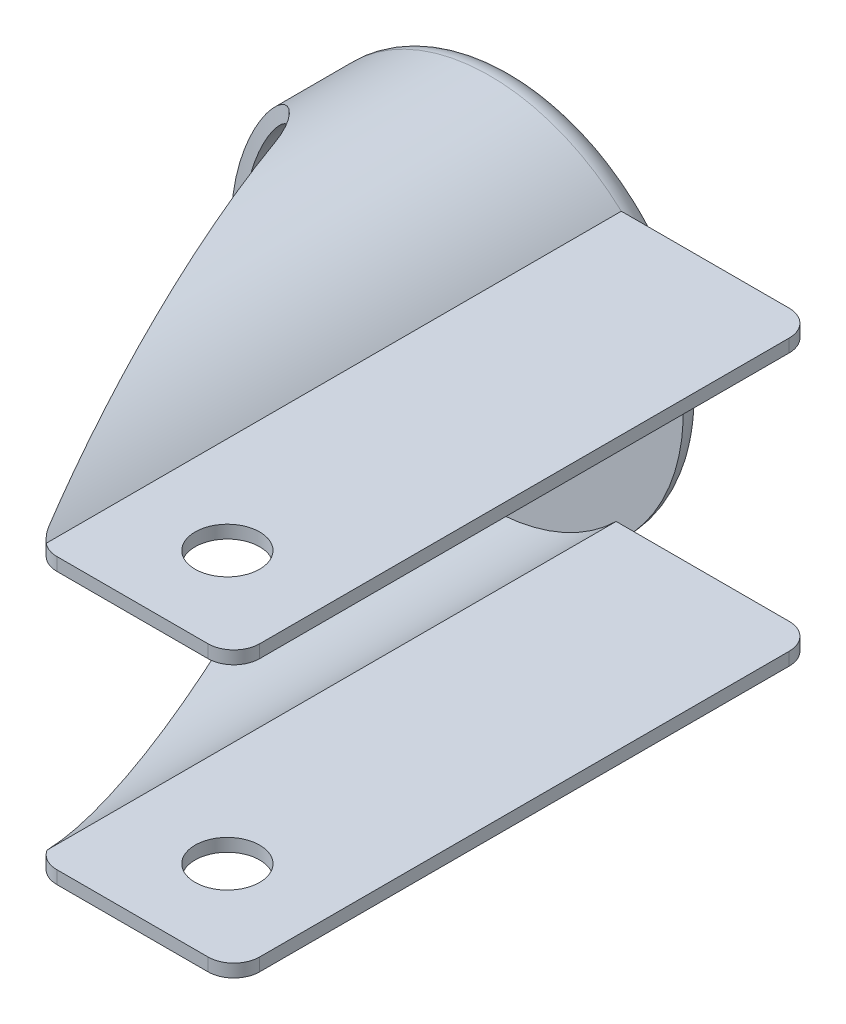
from build123d import *

# Parameters (mm, degrees)
EXTRUDE_1_DEPTH          = 45
SHELL_11_T               = -1
CUT_EXTRUDE_3_DEPTH      = 54.711648372
CUT_EXTRUDE_3_DEPTH_BACK = 54.711648372
CUT_EXTRUDE_5_DEPTH      = 58.757607161
CUT_EXTRUDE_5_DEPTH_BACK = 58.757607161
SKETCH_3_R               = 2.5
EXTRUDE_START            = 2
SKETCH_5_R               = 15
EXTRUDE_4_DEPTH          = 2
FILLET_5_R               = 2
CUT_EXTRUDE_6_DEPTH      = 56.398025084
CUT_EXTRUDE_6_DEPTH_BACK = 56.398025084
SKETCH_6_R               = 5
FILLET_6_R               = 2
FILLET_7_R               = 2


with BuildPart() as part:
    # 草图1 → 凸台-拉伸1 (new body)
    with BuildSketch(Plane.XY):
        with BuildLine():
            Line((10.198039027, -11), (25.198039027, -11))
            Line((25.198039027, -11), (25.198039027, 11))
            Line((25.198039027, 11), (10.198039027, 11))
            ThreePointArc((10.198039027, 11), (-15, 0), (10.198039027, -11))
        make_face()
    extrude(amount=EXTRUDE_1_DEPTH)

    # 抽壳11
    shell_11_openings = [part.faces().sort_by_distance(p)[0] for p in [
        (5.138978192, 0, 45),
        (5.138978192, 0, 0),
        (25.198039027, 0, 22.5),
    ]]
    offset(amount=SHELL_11_T, openings=shell_11_openings, kind=Kind.INTERSECTION)

    # 草图2 → 切除-拉伸3 (cut, two sides: drawn at the far end of the back side and taken through both)
    with BuildSketch(Plane(origin=(0, 0, 0), x_dir=(1, 0, 0), z_dir=(0, 1, 0)).offset(-CUT_EXTRUDE_3_DEPTH_BACK)):
        with BuildLine():
            Line((10.198039027, -45), (-4.526158017, -12.089687708))
            ThreePointArc((-4.526158017, -12.089687708), (-8.753229506, -7.052958097), (-15, -5))
            Line((-15, -5), (-15, -45))
            Line((-15, -45), (10.198039027, -45))
        make_face()
    extrude(amount=CUT_EXTRUDE_3_DEPTH + CUT_EXTRUDE_3_DEPTH_BACK, mode=Mode.SUBTRACT)

    # 草图3 → 切除-拉伸5 (cut, two sides: drawn at the far end of the back side and taken through both)
    with BuildSketch(Plane(origin=(0, 11, 0), x_dir=(1, 0, 0), z_dir=(0, 1, 0)).offset(-CUT_EXTRUDE_5_DEPTH_BACK)):
        with Locations(Location((17.698039027, -38, 0), (0, 0, 270))):
            Circle(SKETCH_3_R)
    extrude(amount=CUT_EXTRUDE_5_DEPTH + CUT_EXTRUDE_5_DEPTH_BACK, mode=Mode.SUBTRACT)

    # 草图5 → 凸台-拉伸4 (add)
    with BuildSketch(Plane(origin=(0, 0, 0), x_dir=(-1, 0, 0), z_dir=(0, 0, -1)).offset(EXTRUDE_START)):
        Circle(SKETCH_5_R)
    extrude(amount=-EXTRUDE_4_DEPTH)

    # 圆角5
    # the kernel refuses this fillet: 2 mm, written as the material it takes off along each edge
    with BuildSketch(Plane(origin=(0, 0, -2), x_dir=(-1, 0, 0), z_dir=(0, -1, 0))) as fillet_5_piece_1:
        with BuildLine():
            CenterArc((15 - FILLET_5_R, -FILLET_5_R), FILLET_5_R, 0, 90)
            Line((15 - FILLET_5_R, 0), (15, 0))
            Line((15, 0), (15, -FILLET_5_R))
        make_face()
    revolve(axis=Axis((0, 0, -2), (0, 0, -1)), mode=Mode.SUBTRACT)

    # 草图6 → 切除-拉伸6 (cut, two sides: drawn at the far end of the back side and taken through both)
    with BuildSketch(Plane(origin=(0, 0, -2), x_dir=(-1, 0, 0), z_dir=(0, 0, -1)).offset(-CUT_EXTRUDE_6_DEPTH_BACK)):
        Circle(SKETCH_6_R)
    extrude(amount=CUT_EXTRUDE_6_DEPTH + CUT_EXTRUDE_6_DEPTH_BACK, mode=Mode.SUBTRACT)

    # 圆角6
    fillet_6_edges = [part.edges().sort_by_distance(p)[0] for p in [
        (25.198039027, 10.5, 0),
        (25.198039027, 10.5, 45),
    ]]
    fillet(fillet_6_edges, radius=FILLET_6_R)

    # 圆角7
    fillet_7_edges = [part.edges().sort_by_distance(p)[0] for p in [
        (10.198039027, -10.5, 45),
        (10.198039027, 10.5, 45),
        (25.198039027, -10.5, 0),
        (25.198039027, -10.5, 45),
    ]]
    fillet(fillet_7_edges, radius=FILLET_7_R)


solid = part.part
